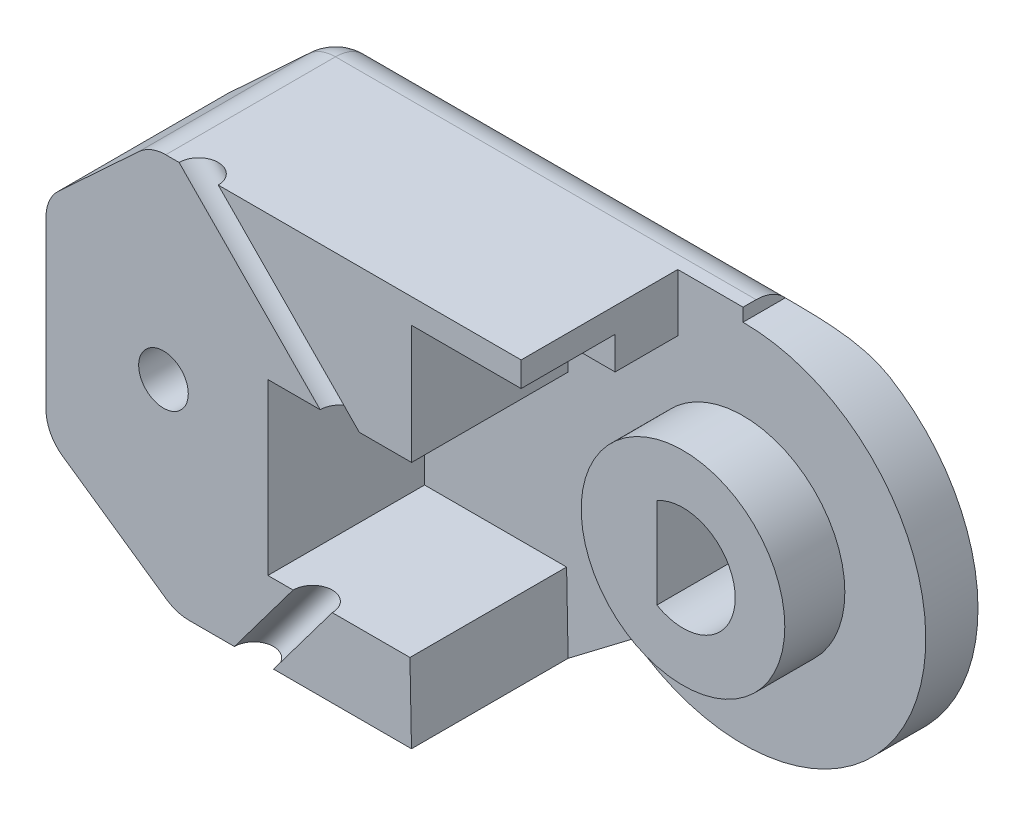
from build123d import *

# Parameters (mm, degrees)
BOSS_EXTRUDE1_DEPTH = 2
BOSS_EXTRUDE2_DEPTH = 6
SKETCH24_R          = 3.9
BOSS_EXTRUDE5_DEPTH = 2.3
SKETCH30_W          = 2.408612022
SKETCH30_H          = 1.324178481
CUT_EXTRUDE12_DEPTH = 8
CUT_EXTRUDE11_DEPTH = 23.432788503
FILLET1_R           = 1.5
SKETCH34_R          = 0.75
CUT_EXTRUDE13_DEPTH = 8
SKETCH35_R          = 0.75
CUT_EXTRUDE14_DEPTH = 8
SKETCH36_R          = 0.95
CUT_EXTRUDE15_DEPTH = 8
SKETCH37_R          = 2
CUT_EXTRUDE16_DEPTH = 5
SKETCH38_W          = 4.196291048
SKETCH38_H          = 1.25
CUT_EXTRUDE17_DEPTH = 3.6


with BuildPart() as part:
    # Sketch2 → Boss-Extrude1 (new body)
    with BuildSketch(Plane.XY):
        with BuildLine():
            Line((-2.5, 7.5), (-16.7, 7.5))
            Line((-16.7, 7.5), (-20.7, 3.793442666))
            Line((-20.7, 3.793442666), (-20.7, -4.031648778))
            Line((-20.7, -4.031648778), (-15.7, -7.5))
            Line((-15.7, -7.5), (-6.7, -7.5))
            Line((-6.7, -7.5), (-4.2, -5.6))
            ThreePointArc((-4.2, -5.6), (3.130495168, -6.260990337), (7, 0))
            ThreePointArc((7, 0), (4.949747468, 4.949747468), (0, 7))
            Line((0, 7), (0, 7.5))
            Line((0, 7.5), (-2.5, 7.5))
        make_face()
    extrude(amount=BOSS_EXTRUDE1_DEPTH)

    # Sketch4 → Boss-Extrude2 (add)
    with BuildSketch(Plane.XY.offset(2)):
        Polygon((-15.7, -7.5), (-6.7, -7.5), (-6.759079174, -4.5), (-12.2, -4.5), (-12.2, 2), (-6.696291048, 2), (-6.696291048, 5.3), (-2.5, 5.3), (-2.5, 7.5), (-16.7, 7.5), (-20.7, 3.793442666), (-20.7, -4.031648778), align=None)
    extrude(amount=BOSS_EXTRUDE2_DEPTH)

    # Sketch24 → Boss-Extrude5 (add)
    with BuildSketch(Plane.XY.offset(2)):
        Circle(SKETCH24_R)
    extrude(amount=BOSS_EXTRUDE5_DEPTH)

    # Sketch30 → Cut-Extrude12 (cut)
    with BuildSketch(Plane(origin=(-6.696291048, 0, 0), x_dir=(0, 0, -1), z_dir=(1, 0, 0))):
        with Locations((-3.261593395, 4.63791076)):
            Rectangle(SKETCH30_W, SKETCH30_H)
    extrude(amount=-CUT_EXTRUDE12_DEPTH, mode=Mode.SUBTRACT)

    # Sketch28 → Cut-Extrude11 (cut, through all)
    with BuildSketch(Plane.XY.offset(4.3)):
        with BuildLine():
            Line((-1, 1.732050808), (-1, -1.732050808))
            ThreePointArc((-1, -1.732050808), (2, 0), (-1, 1.732050808))
        make_face()
    extrude(amount=-CUT_EXTRUDE11_DEPTH, mode=Mode.SUBTRACT)

    # Fillet1
    fillet1_edges = [part.edges().sort_by_distance(p)[0] for p in [
        (-11.2, -7.5, 0),
        (-8.35, 7.5, 0),
        (-18.7, 5.646721333, 0),
        (-18.2, -5.765824389, 0),
        (-20.7, -0.119103056, 0),
        (-15.7, -7.5, 4),
        (-20.7, -4.031648778, 4),
        (-20.7, 3.793442666, 4),
        (-16.7, 7.5, 4),
    ]]
    fillet(fillet1_edges, radius=FILLET1_R)

    # Sketch34 → Cut-Extrude13 (cut, along a direction that is not the sketch's normal)
    with BuildSketch(Plane.XZ.offset(-2)):
        with Locations((-9.448145524, 8)):
            Circle(SKETCH34_R)
    extrude(amount=-CUT_EXTRUDE13_DEPTH, dir=(0.7008928237726356, -0.7132666048428324, 0), mode=Mode.SUBTRACT)

    # Sketch35 → Cut-Extrude14 (cut, along a direction that is not the sketch's normal)
    with BuildSketch(Plane(origin=(0, -4.5, 0), x_dir=(1, 0, 0), z_dir=(0, 1, 0))):
        with Locations((-10.483626668, -8)):
            Circle(SKETCH35_R)
    extrude(amount=-CUT_EXTRUDE14_DEPTH, dir=(0.5999194182208608, 0.8000604299935998, 0), mode=Mode.SUBTRACT)

    # Sketch36 → Cut-Extrude15 (cut)
    with BuildSketch(Plane.XY.offset(8)):
        with Locations((-16.2, 0)):
            Circle(SKETCH36_R)
    extrude(amount=-CUT_EXTRUDE15_DEPTH, mode=Mode.SUBTRACT)

    # Sketch37 → Cut-Extrude16 (cut)
    with BuildSketch(Plane(origin=(0, 0, 0), x_dir=(-1, 0, 0), z_dir=(0, 0, -1))):
        with Locations((16.2, 0)):
            Circle(SKETCH37_R)
    extrude(amount=-CUT_EXTRUDE16_DEPTH, mode=Mode.SUBTRACT)

    # Sketch38 → Cut-Extrude17 (cut)
    with BuildSketch(Plane.XY.offset(8)):
        with Locations((-4.598145524, 5.925)):
            Rectangle(SKETCH38_W, SKETCH38_H)
    extrude(amount=-CUT_EXTRUDE17_DEPTH, mode=Mode.SUBTRACT)


solid = part.part
